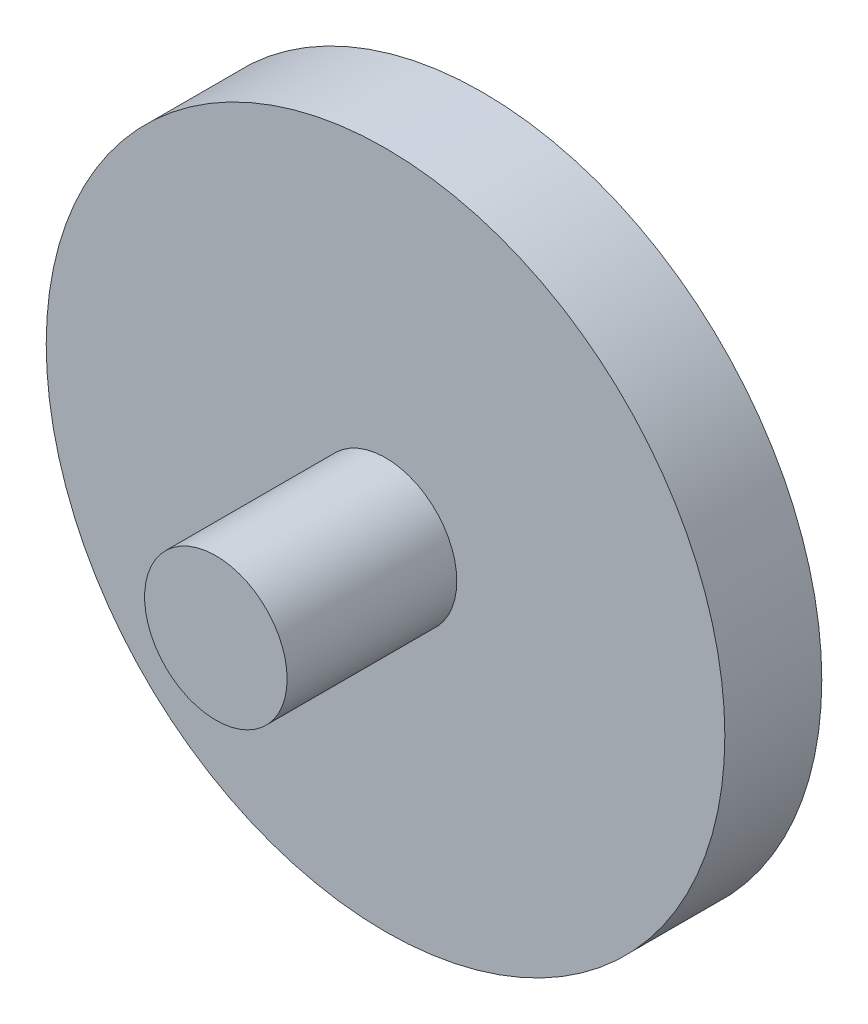
from build123d import *

# Parameters (mm, degrees)
SKETCH1_R           = 14
BOSS_EXTRUDE1_DEPTH = 4
SKETCH2_R           = 2.94
BOSS_EXTRUDE2_DEPTH = 7
SKETCH4_R           = 11
CUT_EXTRUDE1_DEPTH  = 1
FILLET1_R           = 0.5


with BuildPart() as part:
    # Sketch1 → Boss-Extrude1 (new body)
    with BuildSketch(Plane.XY):
        Circle(SKETCH1_R)
    extrude(amount=BOSS_EXTRUDE1_DEPTH)

    # Sketch2 → Boss-Extrude2 (add)
    with BuildSketch(Plane.XY.offset(4)):
        Circle(SKETCH2_R)
    extrude(amount=BOSS_EXTRUDE2_DEPTH)

    # Sketch4 → Cut-Extrude1 (cut)
    with BuildSketch(Plane(origin=(0, 0, 0), x_dir=(-1, 0, 0), z_dir=(0, 0, -1))):
        Circle(SKETCH4_R)
    extrude(amount=-CUT_EXTRUDE1_DEPTH, mode=Mode.SUBTRACT)

    # Fillet1
    fillet1_edges = [part.edges().sort_by_distance(p)[0] for p in [
        (11, 0, 1),
        (11, 0, 0),
    ]]
    fillet(fillet1_edges, radius=FILLET1_R - 0.0001)  # a hair under: the kernel refuses the full size


solid = part.part
